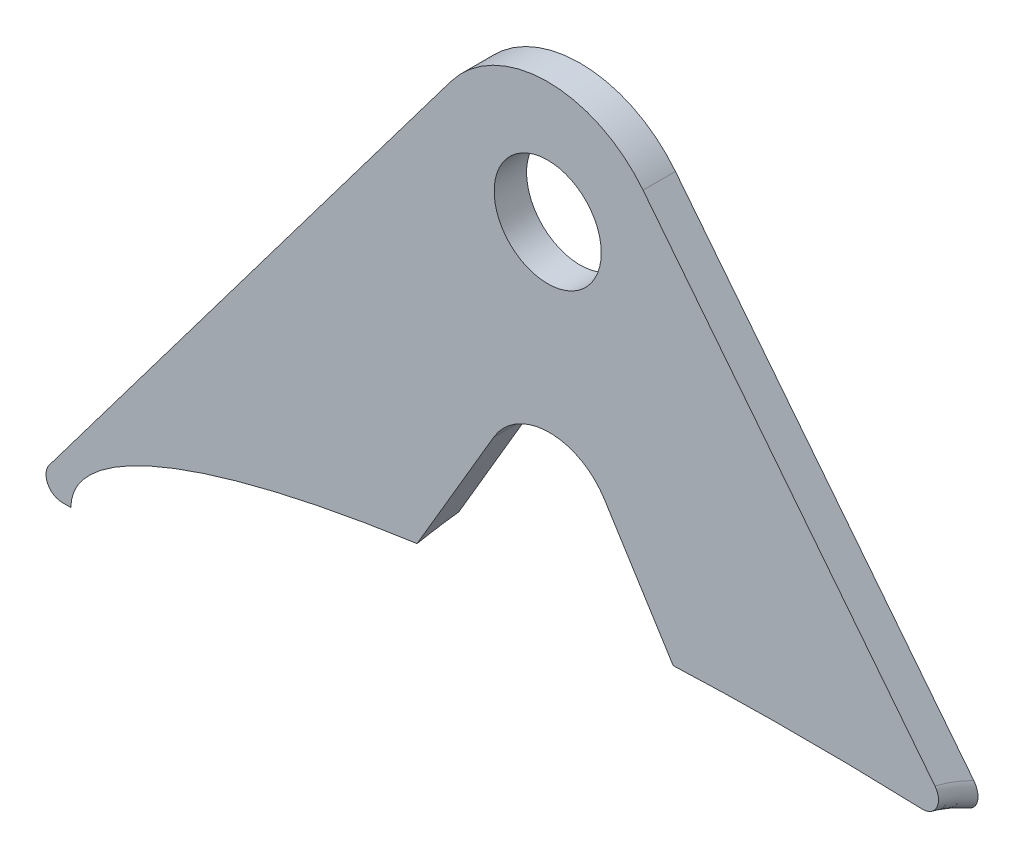
from build123d import *

# Parameters (mm, degrees)
SKETCH1_3_R         = 4.19989
BOSS_EXTRUDE2_DEPTH = 2.54
FILLET2_R           = 5.08
CAVITY1_START       = -13.584565167
CAVITY1_DEPTH       = 81.203953774
FILLET5_R           = 1.27


# Read off the part's stored shape, not the designer's step: Cavity1
with BuildPart() as part:
    # Sketch1<3> → Boss-Extrude2 (new body)
    with BuildSketch(Plane.XY):
        with BuildLine():
            Line((-13.95345355, 0), (9.898255453, 0))
            Line((9.898255453, 0), (26.677907206, 28.575))
            Line((26.677907206, 28.575), (44.597300724, 0))
            Line((44.597300724, 0), (68.859651689, 0))
            Line((68.859651689, 0), (34.156623933, 43.998679608))
            ThreePointArc((34.156623933, 43.998679608), (26.57246445, 47.624416351), (19.070433461, 43.831663652))
            Line((19.070433461, 43.831663652), (-13.95345355, 0))
        make_face()
        with Locations((26.677907206, 38.1)):
            Circle(SKETCH1_3_R, mode=Mode.SUBTRACT)
    extrude(amount=BOSS_EXTRUDE2_DEPTH)

    # Fillet2
    fillet2_edges = [part.edges().sort_by_distance(p)[0] for p in [
        (26.677907206, 28.575, 1.27),
    ]]
    fillet(fillet2_edges, radius=FILLET2_R)

    # Cavity1 outline → Cavity1 (cut)
    with BuildSketch(Plane(origin=(0, 0, 0), x_dir=(0, 1, 0), z_dir=(0.9735629333039064, 0, 0.2284189460108191)).offset(CAVITY1_START)):
        with BuildLine():
            ThreePointArc((11.903524166, -13.584302869), (12.977722099, -9.800919705), (12.878785995, -5.869240546))
            Line((12.878785995, -5.869240546), (12.702012601, -4.875585463))
            Line((12.702012601, -4.875585463), (12.37490895, -3.92080671))
            ThreePointArc((12.37490895, -3.92080671), (7.604419183, 2.483155513), (0, 4.920595493))
            Line((0, 4.920595493), (0, -17))
            Line((0, -17), (10.347145248, -17))
            Line((10.347145248, -17), (11.903524166, -13.584302869))
        make_face()
    extrude(amount=CAVITY1_DEPTH, mode=Mode.SUBTRACT)

    # Fillet5
    fillet5_edges = [part.edges().sort_by_distance(p)[0] for p in [
        (-13.95345355, 0, 2.160215866),
        (59.070501777, 12.411299487, 1.233165923),
    ]]
    fillet(fillet5_edges, radius=FILLET5_R - 0.0004)  # a hair under: the kernel refuses the full size


solid = part.part
